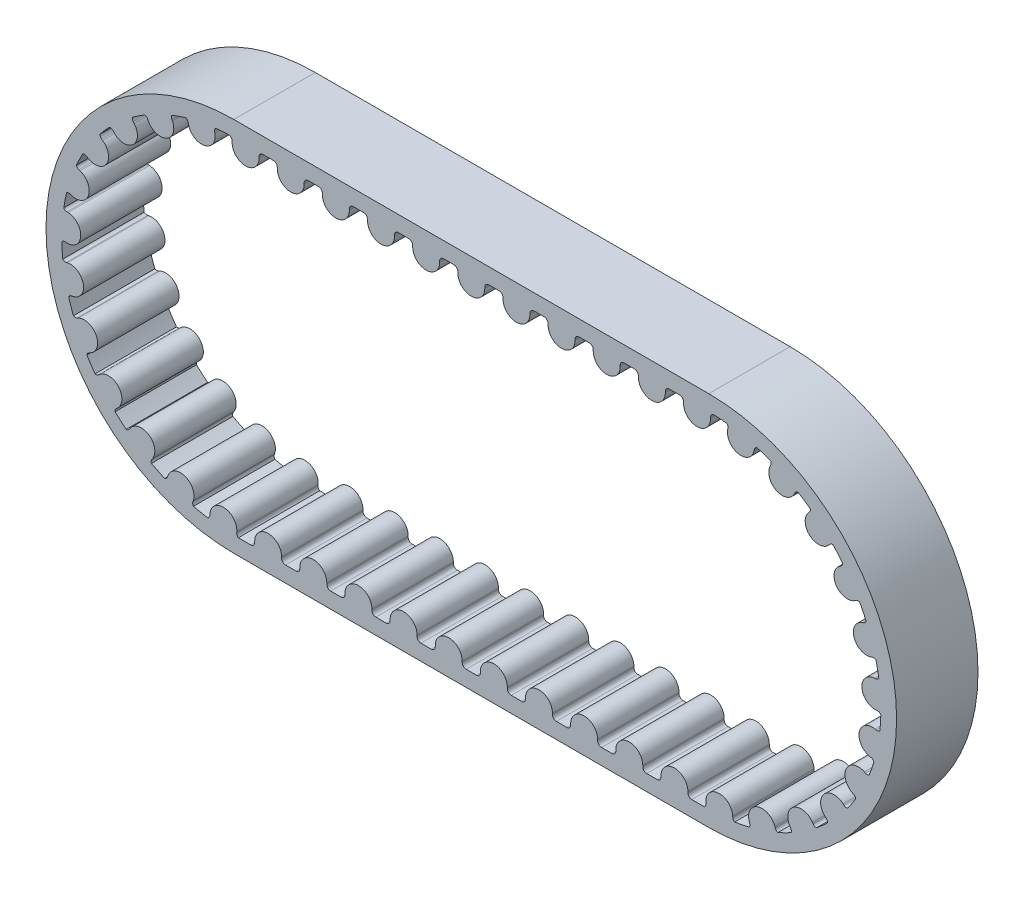
from build123d import *

# Parameters (mm, degrees)
EXTRUDE_THIN1_START = -0.9
EXTRUDE_THIN1_DEPTH = 9
BOSS_EXTRUDE1_DEPTH = 9
CRVPATTERN6_START   = -9.9
CRVPATTERN6_DEPTH   = 9


# Read off the part's stored shape, not the designer's step: CrvPattern6
with BuildPart() as part:
    # Sketch2 → Extrude-Thin1 (new body)
    with BuildSketch(Plane.XY.offset(EXTRUDE_THIN1_START)):
        with BuildLine():
            Line((55, -20.77), (2.5, -20.77))
            ThreePointArc((2.5, -20.77), (-18.27, 0), (2.5, 20.77))
            Line((2.5, 20.77), (55, 20.77))
            ThreePointArc((55, 20.77), (75.77, 0), (55, -20.77))
        make_face()
        with BuildLine():
            Line((55, -19.03), (2.5, -19.03))
            ThreePointArc((2.5, -19.03), (-16.53, 0), (2.5, 19.03))
            Line((2.5, 19.03), (55, 19.03))
            ThreePointArc((55, 19.03), (74.03, 0), (55, -19.03))
        make_face(mode=Mode.SUBTRACT)
    extrude(amount=-EXTRUDE_THIN1_DEPTH)

    # Sketch3 → Boss-Extrude1 (add)
    with BuildSketch(Plane.XY.offset(-0.9)):
        with BuildLine():
            Line((27.26, 18.46), (27.26, 18.6))
            ThreePointArc((27.26, 18.6), (27.134055916, 18.904055916), (26.83, 19.03))
            Line((26.83, 19.03), (30.67, 19.03))
            ThreePointArc((30.67, 19.03), (30.365944084, 18.904055916), (30.24, 18.6))
            Line((30.24, 18.6), (30.24, 18.46))
            ThreePointArc((30.24, 18.46), (28.75, 16.97), (27.26, 18.46))
        make_face()
    extrude(amount=-BOSS_EXTRUDE1_DEPTH)

    # CrvPattern6 outline → CrvPattern6 (add)
    with BuildSketch(Plane.XY.offset(CRVPATTERN6_START)):
        with BuildLine():
            ThreePointArc((22.269577413, 18.46), (23.759577413, 16.97), (25.249577413, 18.46))
            Line((25.249577413, 18.46), (25.249577413, 18.6))
            ThreePointArc((25.249577413, 18.6), (25.375521497, 18.904055915), (25.679577413, 19.03))
            Line((25.679577413, 19.03), (21.839577413, 19.03))
            ThreePointArc((21.839577413, 19.03), (22.143633329, 18.904055916), (22.269577413, 18.6))
            Line((22.269577413, 18.6), (22.269577413, 18.46))
        make_face()
        with BuildLine():
            ThreePointArc((35.230422587, 18.6), (35.356366671, 18.904055916), (35.660422587, 19.03))
            Line((35.660422587, 19.03), (31.820422587, 19.03))
            ThreePointArc((31.820422587, 19.03), (32.124478502, 18.904055916), (32.250422587, 18.6))
            Line((32.250422587, 18.6), (32.250422587, 18.46))
            ThreePointArc((32.250422587, 18.46), (33.740422587, 16.97), (35.230422587, 18.46))
            Line((35.230422587, 18.46), (35.230422587, 18.6))
        make_face()
        with BuildLine():
            ThreePointArc((40.220845173, 18.6), (40.346789257, 18.904055916), (40.650845173, 19.03))
            Line((40.650845173, 19.03), (36.810845173, 19.03))
            ThreePointArc((36.810845173, 19.03), (37.114901089, 18.904055916), (37.240845173, 18.6))
            Line((37.240845173, 18.6), (37.240845173, 18.46))
            ThreePointArc((37.240845173, 18.46), (38.730845173, 16.97), (40.220845173, 18.46))
            Line((40.220845173, 18.46), (40.220845173, 18.6))
        make_face()
        with BuildLine():
            ThreePointArc((45.21126776, 18.6), (45.337211844, 18.904055916), (45.64126776, 19.03))
            Line((45.64126776, 19.03), (41.80126776, 19.03))
            ThreePointArc((41.80126776, 19.03), (42.105323676, 18.904055916), (42.23126776, 18.6))
            Line((42.23126776, 18.6), (42.23126776, 18.46))
            ThreePointArc((42.23126776, 18.46), (43.72126776, 16.97), (45.21126776, 18.46))
            Line((45.21126776, 18.46), (45.21126776, 18.6))
        make_face()
        with BuildLine():
            ThreePointArc((50.201690346, 18.6), (50.32763443, 18.904055916), (50.631690346, 19.03))
            Line((50.631690346, 19.03), (46.791690346, 19.03))
            ThreePointArc((46.791690346, 19.03), (47.095746262, 18.904055916), (47.221690346, 18.6))
            Line((47.221690346, 18.6), (47.221690346, 18.46))
            ThreePointArc((47.221690346, 18.46), (48.711690346, 16.97), (50.201690346, 18.46))
            Line((50.201690346, 18.46), (50.201690346, 18.6))
        make_face()
        with BuildLine():
            ThreePointArc((55.192112933, 18.6), (55.290658777, 18.873930909), (55.541127551, 19.022304828))
            ThreePointArc((55.541127551, 19.022304828), (55.270591132, 19.02807611), (55, 19.03))
            Line((55, 19.03), (51.782112933, 19.03))
            ThreePointArc((51.782112933, 19.03), (52.086168849, 18.904055916), (52.212112933, 18.6))
            Line((52.212112933, 18.6), (52.212112933, 18.46))
            ThreePointArc((52.212112933, 18.46), (53.702112933, 16.97), (55.192112933, 18.46))
            Line((55.192112933, 18.46), (55.192112933, 18.6))
        make_face()
        with BuildLine():
            ThreePointArc((60.048532702, 17.963641545), (60.136474373, 18.151562726), (60.30217476, 18.276428612))
            ThreePointArc((60.30217476, 18.276428612), (58.669408077, 18.672877239), (57.008036227, 18.923759946))
            ThreePointArc((57.008036227, 18.923759946), (57.114164809, 18.745476935), (57.124456287, 18.538251953))
            Line((57.124456287, 18.538251953), (57.097461167, 18.400879236))
            ThreePointArc((57.097461167, 18.400879236), (58.27219417, 16.651535824), (60.021537582, 17.826268828))
            Line((60.021537582, 17.826268828), (60.048532702, 17.963641545))
        make_face()
        with BuildLine():
            ThreePointArc((64.532905433, 16.040692442), (64.666558044, 16.199390543), (64.858964206, 16.277030589))
            ThreePointArc((64.858964206, 16.277030589), (63.384796027, 17.083210927), (61.845263496, 17.756217719))
            ThreePointArc((61.845263496, 17.756217719), (61.901544859, 17.556516652), (61.857762576, 17.35370832))
            Line((61.857762576, 17.35370832), (61.796077267, 17.228030467))
            ThreePointArc((61.796077267, 17.228030467), (62.477140756, 15.2339511), (64.471220123, 15.915014589))
            Line((64.471220123, 15.915014589), (64.532905433, 16.040692442))
        make_face()
        with BuildLine():
            ThreePointArc((68.365451581, 13.020937142), (68.535676435, 13.139560945), (68.741632314, 13.164666397))
            ThreePointArc((68.741632314, 13.164666397), (67.526861082, 14.325454668), (66.214435695, 15.374567702))
            ThreePointArc((66.214435695, 15.374567702), (66.217021517, 15.167103437), (66.122159153, 14.982579077))
            Line((66.122159153, 14.982579077), (66.030001478, 14.877189499))
            ThreePointArc((66.030001478, 14.877189499), (66.170826725, 12.774722318), (68.273293906, 12.915547564))
            Line((68.273293906, 12.915547564), (68.365451581, 13.020937142))
        make_face()
        with BuildLine():
            ThreePointArc((71.284115104, 9.110855904), (71.479272824, 9.18129433), (71.684695881, 9.152148566))
            ThreePointArc((71.684695881, 9.152148566), (70.812383384, 10.588174145), (69.816804179, 11.941658759))
            ThreePointArc((69.816804179, 11.941658759), (69.76551765, 11.740616973), (69.626061559, 11.586993711))
            Line((69.626061559, 11.586993711), (69.509732937, 11.509098579))
            ThreePointArc((69.509732937, 11.509098579), (69.100690805, 9.442002902), (71.167786482, 9.032960771))
            Line((71.167786482, 9.032960771), (71.284115104, 9.110855904))
        make_face()
        with BuildLine():
            ThreePointArc((73.089328043, 4.577806346), (73.29607443, 4.595243064), (73.486918558, 4.513838968))
            ThreePointArc((73.486918558, 4.513838968), (73.016710461, 6.126911471), (72.406051646, 7.692221142))
            ThreePointArc((72.406051646, 7.692221142), (72.304399559, 7.511348366), (72.129885259, 7.399130423))
            Line((72.129885259, 7.399130423), (71.997339833, 7.354055929))
            ThreePointArc((71.997339833, 7.354055929), (71.066399187, 5.463672499), (72.956782617, 4.532731853))
            Line((72.956782617, 4.532731853), (73.089328043, 4.577806346))
        make_face()
        with BuildLine():
            ThreePointArc((73.657656281, -0.268257527), (73.861854744, -0.30501478), (74.025070691, -0.433111081))
            ThreePointArc((74.025070691, -0.433111081), (73.989118171, 1.246712115), (73.80513445, 2.916816467))
            ThreePointArc((73.80513445, 2.916816467), (73.660067419, 2.768480146), (73.462427584, 2.705340589))
            Line((73.462427584, 2.705340589), (73.322728344, 2.696168771))
            ThreePointArc((73.322728344, 2.696168771), (71.933543634, 1.111755364), (73.517957041, -0.277429345))
            Line((73.517957041, -0.277429345), (73.657656281, -0.268257527))
        make_face()
        with BuildLine():
            ThreePointArc((72.950239528, -5.095978892), (73.137927692, -5.184416785), (73.262355327, -5.350446516))
            ThreePointArc((73.262355327, -5.350446516), (73.663116691, -3.718733035), (73.918388225, -2.058029871))
            ThreePointArc((73.918388225, -2.058029871), (73.739825422, -2.16368702), (73.532573971, -2.173430929))
            Line((73.532573971, -2.173430929), (73.39527306, -2.146072935))
            ThreePointArc((73.39527306, -2.146072935), (71.642831857, -3.316179695), (72.812938617, -5.068620898))
            Line((72.812938617, -5.068620898), (72.950239528, -5.095978892))
        make_face()
        with BuildLine():
            ThreePointArc((71.015448458, -9.575255124), (71.173792867, -9.709326583), (71.250924263, -9.901937215))
            ThreePointArc((71.250924263, -9.901937215), (72.060996857, -8.429904285), (72.738069076, -6.892155357))
            ThreePointArc((72.738069076, -6.892155357), (72.538219999, -6.94790887), (72.335528057, -6.903590876))
            Line((72.335528057, -6.903590876), (72.210013629, -6.841573714))
            ThreePointArc((72.210013629, -6.841573714), (70.214141706, -7.517366039), (70.88993403, -9.513237962))
            Line((70.88993403, -9.513237962), (71.015448458, -9.575255124))
        make_face()
        with BuildLine():
            ThreePointArc((67.985577286, -13.399809049), (68.103750905, -13.570346739), (68.128312089, -13.776368233))
            ThreePointArc((68.128312089, -13.776368233), (69.292305995, -12.564668294), (70.344883079, -11.255019472))
            ThreePointArc((70.344883079, -11.255019472), (70.137412705, -11.257057119), (69.953139636, -11.161707532))
            Line((69.953139636, -11.161707532), (69.847993927, -11.069271717))
            ThreePointArc((69.847993927, -11.069271717), (67.745161993, -11.2045413), (67.880431577, -13.307373234))
            Line((67.880431577, -13.307373234), (67.985577286, -13.399809049))
        make_face()
        with BuildLine():
            ThreePointArc((64.067797958, -16.308131106), (64.13772049, -16.503474259), (64.108032056, -16.70881959))
            ThreePointArc((64.108032056, -16.70881959), (65.546357459, -15.840304427), (66.902467884, -14.848304895))
            ThreePointArc((66.902467884, -14.848304895), (66.70156231, -14.79648735), (66.548308058, -14.65662584))
            Line((66.548308058, -14.65662584), (66.470720562, -14.540091808))
            ThreePointArc((66.470720562, -14.540091808), (64.404712879, -14.125589392), (63.990210463, -16.191597075))
            Line((63.990210463, -16.191597075), (64.067797958, -16.308131106))
        make_face()
        with BuildLine():
            ThreePointArc((59.529994463, -18.101360451), (59.546884851, -18.308152188), (59.464976788, -18.498780562))
            ThreePointArc((59.464976788, -18.498780562), (61.079286051, -18.032836191), (62.646203751, -17.426315394))
            ThreePointArc((62.646203751, -17.426315394), (62.465600193, -17.324185757), (62.353843746, -17.149375562))
            Line((62.353843746, -17.149375562), (62.309119623, -17.016711502))
            ThreePointArc((62.309119623, -17.016711502), (60.421202538, -16.080779305), (59.485270341, -17.96869639))
            Line((59.485270341, -17.96869639), (59.529994463, -18.101360451))
        make_face()
        with BuildLine():
            ThreePointArc((54.68244586, -18.656882359), (54.643025191, -18.865610335), (54.508498633, -19.03))
            Line((54.508498633, -19.03), (55, -19.03))
            ThreePointArc((55, -19.03), (56.437668091, -18.975616208), (57.867119067, -18.812775666))
            ThreePointArc((57.867119067, -18.812775666), (57.719166562, -18.667317204), (57.656549433, -18.469511231))
            Line((57.656549433, -18.469511231), (57.647746762, -18.329788244))
            ThreePointArc((57.647746762, -18.329788244), (56.067009411, -16.936422022), (54.67364319, -18.517159373))
            Line((54.67364319, -18.517159373), (54.68244586, -18.656882359))
        make_face()
        with BuildLine():
            ThreePointArc((49.71690164, -18.6), (49.590957556, -18.904055915), (49.28690164, -19.03))
            Line((49.28690164, -19.03), (53.12690164, -19.03))
            ThreePointArc((53.12690164, -19.03), (52.822845724, -18.904055916), (52.69690164, -18.6))
            Line((52.69690164, -18.6), (52.69690164, -18.46))
            ThreePointArc((52.69690164, -18.46), (51.20690164, -16.97), (49.71690164, -18.46))
            Line((49.71690164, -18.46), (49.71690164, -18.6))
        make_face()
        with BuildLine():
            ThreePointArc((44.726479053, -18.6), (44.600534969, -18.904055916), (44.296479053, -19.03))
            Line((44.296479053, -19.03), (48.136479053, -19.03))
            ThreePointArc((48.136479053, -19.03), (47.832423137, -18.904055916), (47.706479053, -18.6))
            Line((47.706479053, -18.6), (47.706479053, -18.46))
            ThreePointArc((47.706479053, -18.46), (46.216479053, -16.97), (44.726479053, -18.46))
            Line((44.726479053, -18.46), (44.726479053, -18.6))
        make_face()
        with BuildLine():
            ThreePointArc((39.736056466, -18.6), (39.610112382, -18.904055916), (39.306056466, -19.03))
            Line((39.306056466, -19.03), (43.146056466, -19.03))
            ThreePointArc((43.146056466, -19.03), (42.84200055, -18.904055915), (42.716056466, -18.6))
            Line((42.716056466, -18.6), (42.716056466, -18.46))
            ThreePointArc((42.716056466, -18.46), (41.226056466, -16.97), (39.736056466, -18.46))
            Line((39.736056466, -18.46), (39.736056466, -18.6))
        make_face()
        with BuildLine():
            ThreePointArc((34.74563388, -18.6), (34.619689796, -18.904055916), (34.31563388, -19.03))
            Line((34.31563388, -19.03), (38.15563388, -19.03))
            ThreePointArc((38.15563388, -19.03), (37.851577964, -18.904055916), (37.72563388, -18.6))
            Line((37.72563388, -18.6), (37.72563388, -18.46))
            ThreePointArc((37.72563388, -18.46), (36.23563388, -16.97), (34.74563388, -18.46))
            Line((34.74563388, -18.46), (34.74563388, -18.6))
        make_face()
        with BuildLine():
            ThreePointArc((29.755211293, -18.6), (29.629267209, -18.904055916), (29.325211293, -19.03))
            Line((29.325211293, -19.03), (33.165211293, -19.03))
            ThreePointArc((33.165211293, -19.03), (32.861155377, -18.904055916), (32.735211293, -18.6))
            Line((32.735211293, -18.6), (32.735211293, -18.46))
            ThreePointArc((32.735211293, -18.46), (31.245211293, -16.97), (29.755211293, -18.46))
            Line((29.755211293, -18.46), (29.755211293, -18.6))
        make_face()
        with BuildLine():
            ThreePointArc((24.764788707, -18.6), (24.638844623, -18.904055916), (24.334788707, -19.03))
            Line((24.334788707, -19.03), (28.174788707, -19.03))
            ThreePointArc((28.174788707, -19.03), (27.870732791, -18.904055916), (27.744788707, -18.6))
            Line((27.744788707, -18.6), (27.744788707, -18.46))
            ThreePointArc((27.744788707, -18.46), (26.254788707, -16.97), (24.764788707, -18.46))
            Line((24.764788707, -18.46), (24.764788707, -18.6))
        make_face()
        with BuildLine():
            ThreePointArc((19.77436612, -18.6), (19.648422036, -18.904055916), (19.34436612, -19.03))
            Line((19.34436612, -19.03), (23.18436612, -19.03))
            ThreePointArc((23.18436612, -19.03), (22.880310204, -18.904055916), (22.75436612, -18.6))
            Line((22.75436612, -18.6), (22.75436612, -18.46))
            ThreePointArc((22.75436612, -18.46), (21.26436612, -16.97), (19.77436612, -18.46))
            Line((19.77436612, -18.46), (19.77436612, -18.6))
        make_face()
        with BuildLine():
            ThreePointArc((14.783943534, -18.6), (14.65799945, -18.904055915), (14.353943534, -19.03))
            Line((14.353943534, -19.03), (18.193943534, -19.03))
            ThreePointArc((18.193943534, -19.03), (17.889887618, -18.904055916), (17.763943534, -18.6))
            Line((17.763943534, -18.6), (17.763943534, -18.46))
            ThreePointArc((17.763943534, -18.46), (16.273943534, -16.97), (14.783943534, -18.46))
            Line((14.783943534, -18.46), (14.783943534, -18.6))
        make_face()
        with BuildLine():
            ThreePointArc((9.793520947, -18.6), (9.667576863, -18.904055916), (9.363520947, -19.03))
            Line((9.363520947, -19.03), (13.203520947, -19.03))
            ThreePointArc((13.203520947, -19.03), (12.899465031, -18.904055916), (12.773520947, -18.6))
            Line((12.773520947, -18.6), (12.773520947, -18.46))
            ThreePointArc((12.773520947, -18.46), (11.283520947, -16.97), (9.793520947, -18.46))
            Line((9.793520947, -18.46), (9.793520947, -18.6))
        make_face()
        with BuildLine():
            ThreePointArc((4.80309836, -18.6), (4.677154276, -18.904055916), (4.37309836, -19.03))
            Line((4.37309836, -19.03), (8.21309836, -19.03))
            ThreePointArc((8.21309836, -19.03), (7.909042445, -18.904055916), (7.78309836, -18.6))
            Line((7.78309836, -18.6), (7.78309836, -18.46))
            ThreePointArc((7.78309836, -18.46), (6.29309836, -16.97), (4.80309836, -18.46))
            Line((4.80309836, -18.46), (4.80309836, -18.6))
        make_face()
        with BuildLine():
            ThreePointArc((-0.156549433, -18.469511231), (-0.219166562, -18.667317204), (-0.367119067, -18.812775666))
            ThreePointArc((-0.367119067, -18.812775666), (1.062331909, -18.975616208), (2.5, -19.03))
            Line((2.5, -19.03), (2.991501367, -19.03))
            ThreePointArc((2.991501367, -19.03), (2.856974809, -18.865610335), (2.81755414, -18.656882359))
            Line((2.81755414, -18.656882359), (2.82635681, -18.517159373))
            ThreePointArc((2.82635681, -18.517159373), (1.432990589, -16.936422022), (-0.147746762, -18.329788244))
            Line((-0.147746762, -18.329788244), (-0.156549433, -18.469511231))
        make_face()
        with BuildLine():
            ThreePointArc((-4.853843746, -17.149375562), (-4.965600193, -17.324185757), (-5.146203751, -17.426315394))
            ThreePointArc((-5.146203751, -17.426315394), (-3.579286051, -18.032836191), (-1.964976788, -18.498780562))
            ThreePointArc((-1.964976788, -18.498780562), (-2.046884851, -18.308152188), (-2.029994463, -18.101360451))
            Line((-2.029994463, -18.101360451), (-1.985270341, -17.96869639))
            ThreePointArc((-1.985270341, -17.96869639), (-2.921202538, -16.080779305), (-4.809119623, -17.016711502))
            Line((-4.809119623, -17.016711502), (-4.853843746, -17.149375562))
        make_face()
        with BuildLine():
            ThreePointArc((-9.048308058, -14.65662584), (-9.20156231, -14.79648735), (-9.402467884, -14.848304895))
            ThreePointArc((-9.402467884, -14.848304895), (-8.046357459, -15.840304427), (-6.608032056, -16.708819589))
            ThreePointArc((-6.608032056, -16.708819589), (-6.63772049, -16.503474259), (-6.567797958, -16.308131106))
            Line((-6.567797958, -16.308131106), (-6.490210463, -16.191597075))
            ThreePointArc((-6.490210463, -16.191597075), (-6.904712879, -14.125589392), (-8.970720562, -14.540091808))
            Line((-8.970720562, -14.540091808), (-9.048308058, -14.65662584))
        make_face()
        with BuildLine():
            ThreePointArc((-12.453139636, -11.161707532), (-12.637412705, -11.257057119), (-12.844883079, -11.255019472))
            ThreePointArc((-12.844883079, -11.255019472), (-11.792305995, -12.564668294), (-10.628312089, -13.776368233))
            ThreePointArc((-10.628312089, -13.776368233), (-10.603750905, -13.570346739), (-10.485577286, -13.399809049))
            Line((-10.485577286, -13.399809049), (-10.380431577, -13.307373234))
            ThreePointArc((-10.380431577, -13.307373234), (-10.245161993, -11.2045413), (-12.347993927, -11.069271717))
            Line((-12.347993927, -11.069271717), (-12.453139636, -11.161707532))
        make_face()
        with BuildLine():
            ThreePointArc((-14.835528057, -6.903590876), (-15.038219999, -6.94790887), (-15.238069076, -6.892155357))
            ThreePointArc((-15.238069076, -6.892155357), (-14.560996857, -8.429904285), (-13.750924263, -9.901937215))
            ThreePointArc((-13.750924263, -9.901937215), (-13.673792867, -9.709326583), (-13.515448458, -9.575255124))
            Line((-13.515448458, -9.575255124), (-13.38993403, -9.513237962))
            ThreePointArc((-13.38993403, -9.513237962), (-12.714141706, -7.517366039), (-14.710013629, -6.841573714))
            Line((-14.710013629, -6.841573714), (-14.835528057, -6.903590876))
        make_face()
        with BuildLine():
            ThreePointArc((-16.032573971, -2.173430929), (-16.239825422, -2.16368702), (-16.418388225, -2.058029871))
            ThreePointArc((-16.418388225, -2.058029871), (-16.163116691, -3.718733035), (-15.762355327, -5.350446516))
            ThreePointArc((-15.762355327, -5.350446516), (-15.637927692, -5.184416785), (-15.450239528, -5.095978892))
            Line((-15.450239528, -5.095978892), (-15.312938617, -5.068620898))
            ThreePointArc((-15.312938617, -5.068620898), (-14.142831857, -3.316179695), (-15.89527306, -2.146072935))
            Line((-15.89527306, -2.146072935), (-16.032573971, -2.173430929))
        make_face()
        with BuildLine():
            ThreePointArc((-15.962427584, 2.705340589), (-16.160067419, 2.768480146), (-16.30513445, 2.916816467))
            ThreePointArc((-16.30513445, 2.916816467), (-16.489118171, 1.246712115), (-16.525070691, -0.433111081))
            ThreePointArc((-16.525070691, -0.433111081), (-16.361854744, -0.30501478), (-16.157656281, -0.268257527))
            Line((-16.157656281, -0.268257527), (-16.017957041, -0.277429345))
            ThreePointArc((-16.017957041, -0.277429345), (-14.433543634, 1.111755364), (-15.822728344, 2.696168771))
            Line((-15.822728344, 2.696168771), (-15.962427584, 2.705340589))
        make_face()
        with BuildLine():
            ThreePointArc((-14.629885259, 7.399130423), (-14.804399559, 7.511348366), (-14.906051646, 7.692221142))
            ThreePointArc((-14.906051646, 7.692221142), (-15.516710461, 6.126911471), (-15.986918558, 4.513838968))
            ThreePointArc((-15.986918558, 4.513838968), (-15.79607443, 4.595243064), (-15.589328043, 4.577806346))
            Line((-15.589328043, 4.577806346), (-15.456782617, 4.532731853))
            ThreePointArc((-15.456782617, 4.532731853), (-13.566399187, 5.463672499), (-14.497339833, 7.354055929))
            Line((-14.497339833, 7.354055929), (-14.629885259, 7.399130423))
        make_face()
        with BuildLine():
            ThreePointArc((-12.126061559, 11.586993711), (-12.26551765, 11.740616973), (-12.316804179, 11.941658759))
            ThreePointArc((-12.316804179, 11.941658759), (-13.312383384, 10.588174145), (-14.184695881, 9.152148566))
            ThreePointArc((-14.184695881, 9.152148566), (-13.979272824, 9.18129433), (-13.784115104, 9.110855904))
            Line((-13.784115104, 9.110855904), (-13.667786482, 9.032960771))
            ThreePointArc((-13.667786482, 9.032960771), (-11.600690805, 9.442002902), (-12.009732937, 11.509098579))
            Line((-12.009732937, 11.509098579), (-12.126061559, 11.586993711))
        make_face()
        with BuildLine():
            ThreePointArc((-8.622159153, 14.982579077), (-8.717021517, 15.167103437), (-8.714435695, 15.374567702))
            ThreePointArc((-8.714435695, 15.374567702), (-10.026861082, 14.325454668), (-11.241632314, 13.164666397))
            ThreePointArc((-11.241632314, 13.164666397), (-11.035676435, 13.139560945), (-10.865451581, 13.020937142))
            Line((-10.865451581, 13.020937142), (-10.773293906, 12.915547564))
            ThreePointArc((-10.773293906, 12.915547564), (-8.670826725, 12.774722318), (-8.530001478, 14.877189499))
            Line((-8.530001478, 14.877189499), (-8.622159153, 14.982579077))
        make_face()
        with BuildLine():
            ThreePointArc((-4.357762576, 17.35370832), (-4.401544859, 17.556516652), (-4.345263496, 17.756217718))
            ThreePointArc((-4.345263496, 17.756217718), (-5.884796027, 17.083210927), (-7.358964206, 16.277030589))
            ThreePointArc((-7.358964206, 16.277030589), (-7.166558044, 16.199390543), (-7.032905433, 16.040692442))
            Line((-7.032905433, 16.040692442), (-6.971220123, 15.915014589))
            ThreePointArc((-6.971220123, 15.915014589), (-4.977140756, 15.2339511), (-4.296077267, 17.228030467))
            Line((-4.296077267, 17.228030467), (-4.357762576, 17.35370832))
        make_face()
        with BuildLine():
            ThreePointArc((0.375543713, 18.538251953), (0.385835191, 18.745476935), (0.491963773, 18.923759946))
            ThreePointArc((0.491963773, 18.923759946), (-1.169408077, 18.672877239), (-2.80217476, 18.276428612))
            ThreePointArc((-2.80217476, 18.276428612), (-2.636474373, 18.151562726), (-2.548532702, 17.963641545))
            Line((-2.548532702, 17.963641545), (-2.521537582, 17.826268828))
            ThreePointArc((-2.521537582, 17.826268828), (-0.77219417, 16.651535824), (0.402538833, 18.400879236))
            Line((0.402538833, 18.400879236), (0.375543713, 18.538251953))
        make_face()
        with BuildLine():
            ThreePointArc((5.287887067, 18.6), (5.413831151, 18.904055916), (5.717887067, 19.03))
            Line((5.717887067, 19.03), (2.5, 19.03))
            ThreePointArc((2.5, 19.03), (2.229408868, 19.02807611), (1.958872449, 19.022304828))
            ThreePointArc((1.958872449, 19.022304828), (2.209341223, 18.873930909), (2.307887067, 18.6))
            Line((2.307887067, 18.6), (2.307887067, 18.46))
            ThreePointArc((2.307887067, 18.46), (3.797887067, 16.97), (5.287887067, 18.46))
            Line((5.287887067, 18.46), (5.287887067, 18.6))
        make_face()
        with BuildLine():
            ThreePointArc((10.278309654, 18.6), (10.404253738, 18.904055916), (10.708309654, 19.03))
            Line((10.708309654, 19.03), (6.868309654, 19.03))
            ThreePointArc((6.868309654, 19.03), (7.17236557, 18.904055916), (7.298309654, 18.6))
            Line((7.298309654, 18.6), (7.298309654, 18.46))
            ThreePointArc((7.298309654, 18.46), (8.788309654, 16.97), (10.278309654, 18.46))
            Line((10.278309654, 18.46), (10.278309654, 18.6))
        make_face()
        with BuildLine():
            ThreePointArc((15.26873224, 18.6), (15.394676324, 18.904055916), (15.69873224, 19.03))
            Line((15.69873224, 19.03), (11.85873224, 19.03))
            ThreePointArc((11.85873224, 19.03), (12.162788156, 18.904055916), (12.28873224, 18.6))
            Line((12.28873224, 18.6), (12.28873224, 18.46))
            ThreePointArc((12.28873224, 18.46), (13.77873224, 16.97), (15.26873224, 18.46))
            Line((15.26873224, 18.46), (15.26873224, 18.6))
        make_face()
        with BuildLine():
            ThreePointArc((20.259154827, 18.6), (20.385098911, 18.904055916), (20.689154827, 19.03))
            Line((20.689154827, 19.03), (16.849154827, 19.03))
            ThreePointArc((16.849154827, 19.03), (17.153210743, 18.904055916), (17.279154827, 18.6))
            Line((17.279154827, 18.6), (17.279154827, 18.46))
            ThreePointArc((17.279154827, 18.46), (18.769154827, 16.97), (20.259154827, 18.46))
            Line((20.259154827, 18.46), (20.259154827, 18.6))
        make_face()
    extrude(amount=CRVPATTERN6_DEPTH)


solid = part.part
